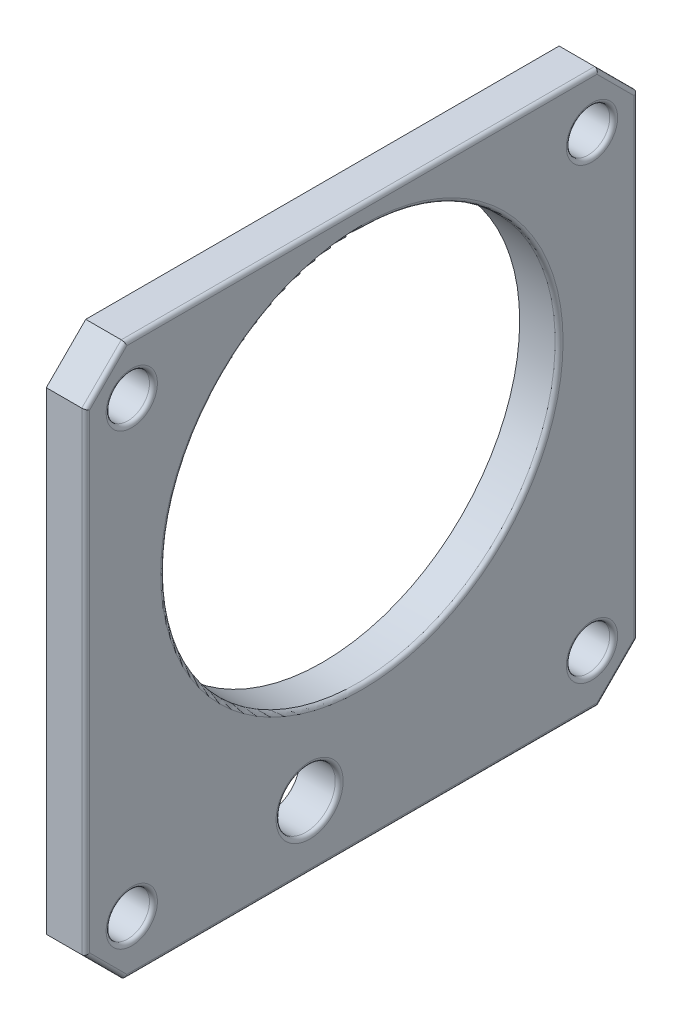
from build123d import *

# Parameters (mm, degrees)
SKETCH1_R               = 15
BOSS_EXTRUDE1_DEPTH     = 3
CUT_EXTRUDE1_DEPTH      = 30.849623113
CUT_EXTRUDE1_DEPTH_BACK = 30.849623113
SKETCH2_R               = 1.65
SKETCH4_R               = 2.25
CUT_EXTRUDE2_DEPTH      = 30.849623113
FILLET1_R               = 0.3


with BuildPart() as part:
    # Sketch1 → Boss-Extrude1 (new body)
    with BuildSketch(Plane(origin=(0, 0, 0), x_dir=(0, 0, -1), z_dir=(1, 0, 0))):
        Polygon((-21, 18), (-18, 21), (18, 21), (21, 18), (21, -18), (18, -21), (-18, -21), (-21, -18), align=None)
        with Locations((0, 4.4)):
            Circle(SKETCH1_R, mode=Mode.SUBTRACT)
    extrude(amount=BOSS_EXTRUDE1_DEPTH)

    # Sketch2 → Cut-Extrude1 (cut, two sides: drawn at the far end of the back side and taken through both)
    with BuildSketch(Plane.ZY.offset(-CUT_EXTRUDE1_DEPTH_BACK)):
        with Locations((-17.499503476, 17.062044783)):
            Circle(SKETCH2_R)
        with Locations((-17.499503476, -17.062044783)):
            Circle(SKETCH2_R)
        with Locations((17.499503476, -17.062044783)):
            Circle(SKETCH2_R)
        with Locations((17.499503476, 17.062044783)):
            Circle(SKETCH2_R)
    extrude(amount=CUT_EXTRUDE1_DEPTH + CUT_EXTRUDE1_DEPTH_BACK, mode=Mode.SUBTRACT)

    # Sketch4 → Cut-Extrude2 (cut, through all)
    with BuildSketch(Plane.ZY):
        with Locations((3.974971526, -16.2)):
            Circle(SKETCH4_R)
    extrude(amount=-CUT_EXTRUDE2_DEPTH, mode=Mode.SUBTRACT)

    # Fillet1
    fillet1_edges = [part.edges().sort_by_distance(p)[0] for p in [
        (3, 4.4, 15),
        (3, 19.5, -19.5),
        (3, 0, -21),
        (3, -19.5, -19.5),
        (3, -21, 0),
        (3, -19.5, 19.5),
        (3, 0, 21),
        (3, 19.5, 19.5),
        (3, 21, 0),
        (3, -17.062044783, -19.149503476),
        (3, 17.062044783, 15.849503476),
        (3, 17.062044783, -19.149503476),
        (3, -17.062044783, 15.849503476),
        (3, -16.2, 1.724971526),
    ]]
    fillet(fillet1_edges, radius=FILLET1_R)


solid = part.part
